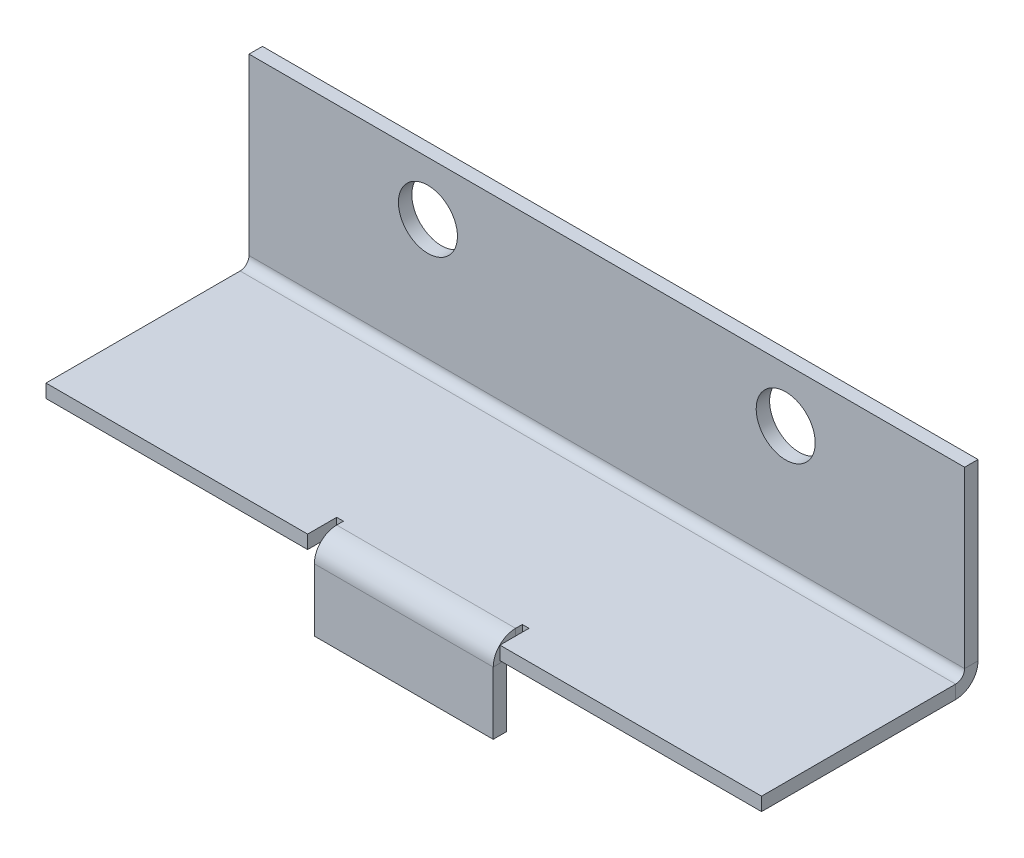
from build123d import *

# Parameters (mm, degrees)
SM_BASE_FLANGE_1_DEPTH            = 40
SM_EDGE_FLANGE_1_STRIP_W          = 8
SM_EDGE_FLANGE_1_STRIP_H          = 1.5
SM_EDGE_FLANGE_1_STRIP_CUT_DEPTH  = 20
SM_EDGE_FLANGE_1_RELIEF_W         = 8.75
SM_EDGE_FLANGE_1_RELIEF_H         = 0.75
SM_EDGE_FLANGE_1_RELIEF_CUT_DEPTH = 1.5
SM_EDGE_FLANGE_1_DEPTH            = 20
HOLE_WIZARD_M6_1_D                = 6.6


# Sheet-metal steps are written as plain solids
with BuildPart() as part:
    # Sketch 1 → 基体-法兰1 (new, symmetric)
    with BuildSketch(Plane(origin=(0, 0, 0), x_dir=(0, 0, -1), z_dir=(1, 0, 0))):
        with BuildLine():
            Line((0, 0), (0, -19.5))
            ThreePointArc((0, -19.5), (-0.732233047, -21.267766953), (-2.5, -22))
            Line((-2.5, -22), (-24.2, -22))
            Line((-24.2, -22), (-24.2, -20.5))
            Line((-24.2, -20.5), (-2.5, -20.5))
            ThreePointArc((-2.5, -20.5), (-1.792893219, -20.207106781), (-1.5, -19.5))
            Line((-1.5, -19.5), (-1.5, 0))
            Line((-1.5, 0), (0, 0))
        make_face()
    extrude(amount=SM_BASE_FLANGE_1_DEPTH, both=True)

    # 边线-法兰1 strip (across the edge) → 边线-法兰1 strip cut (cut)
    with BuildSketch(Plane(origin=(10, -22, 24.2), x_dir=(0, 0, -1), z_dir=(-1, 0, 0))):
        with Locations((-1.5, -0.75)):
            Rectangle(SM_EDGE_FLANGE_1_STRIP_W, SM_EDGE_FLANGE_1_STRIP_H)
    extrude(amount=SM_EDGE_FLANGE_1_STRIP_CUT_DEPTH, mode=Mode.SUBTRACT)

    # 边线-法兰1 relief (on the sheet) → 边线-法兰1 relief cut (cut)
    with BuildSketch(Plane(origin=(10, -22, 21.7), x_dir=(0, 0, -1), z_dir=(0, -1, 0))):
        with Locations((-3.625, 0.375)):
            Rectangle(SM_EDGE_FLANGE_1_RELIEF_W, SM_EDGE_FLANGE_1_RELIEF_H)
        with Locations((-3.625, -20.375)):
            Rectangle(SM_EDGE_FLANGE_1_RELIEF_W, SM_EDGE_FLANGE_1_RELIEF_H)
    extrude(amount=-SM_EDGE_FLANGE_1_RELIEF_CUT_DEPTH, mode=Mode.SUBTRACT)

    # 边线-法兰1 section (across the edge) → 边线-法兰1 (add)
    with BuildSketch(Plane(origin=(10, -22, 24.2), x_dir=(0, 0, -1), z_dir=(-1, 0, 0))):
        with BuildLine():
            Line((0, 1), (0, 8))
            Line((0, 8), (1.5, 8))
            Line((1.5, 8), (1.5, 1))
            ThreePointArc((1.5, 1), (1.792893219, 0.292893219), (2.5, 0))
            Line((2.5, 0), (2.5, -1.5))
            ThreePointArc((2.5, -1.5), (0.732233047, -0.767766953), (0, 1))
        make_face()
    extrude(amount=SM_EDGE_FLANGE_1_DEPTH)

    # M6 间隙孔1 (through all)
    with Locations(Plane(origin=(0, 0, 0), x_dir=(-1, 0, 0), z_dir=(0, 0, -1))):
        with Locations((-20, -6), (20, -6)):
            Hole(HOLE_WIZARD_M6_1_D / 2)


solid = part.part
